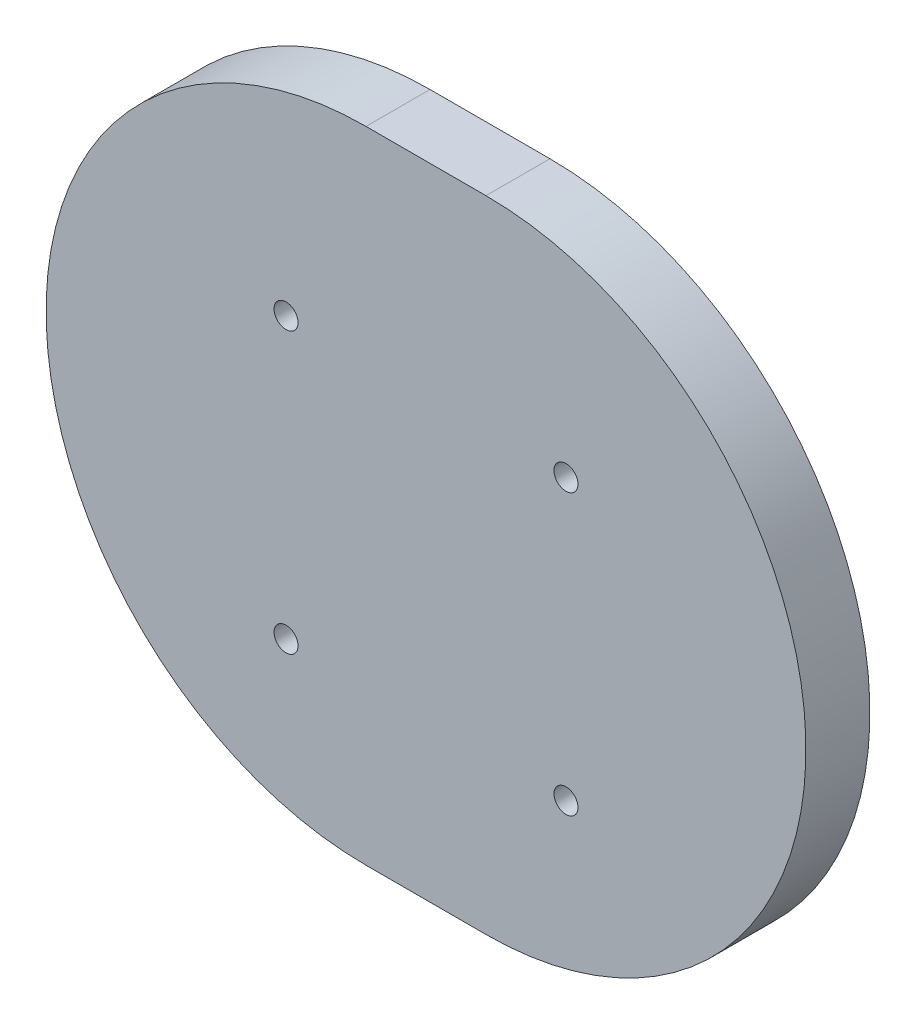
from build123d import *

# Parameters (mm, degrees)
SKETCH1_R           = 0.3
BOSS_EXTRUDE1_DEPTH = 1.6


with BuildPart() as part:
    # Sketch1 → Boss-Extrude1 (new body)
    with BuildSketch(Plane.XY):
        with BuildLine():
            Line((-1.5, 8), (1.5, 8))
            ThreePointArc((1.5, 8), (9.5, 0), (1.5, -8))
            Line((1.5, -8), (-1.5, -8))
            ThreePointArc((-1.5, -8), (-9.5, 0), (-1.5, 8))
        make_face()
        with Locations((3.5, 2.9)):
            Circle(SKETCH1_R, mode=Mode.SUBTRACT)
        with Locations((-3.5, 2.9)):
            Circle(SKETCH1_R, mode=Mode.SUBTRACT)
        with Locations((-3.5, -4.1)):
            Circle(SKETCH1_R, mode=Mode.SUBTRACT)
        with Locations((3.5, -4.1)):
            Circle(SKETCH1_R, mode=Mode.SUBTRACT)
    extrude(amount=BOSS_EXTRUDE1_DEPTH)


solid = part.part
